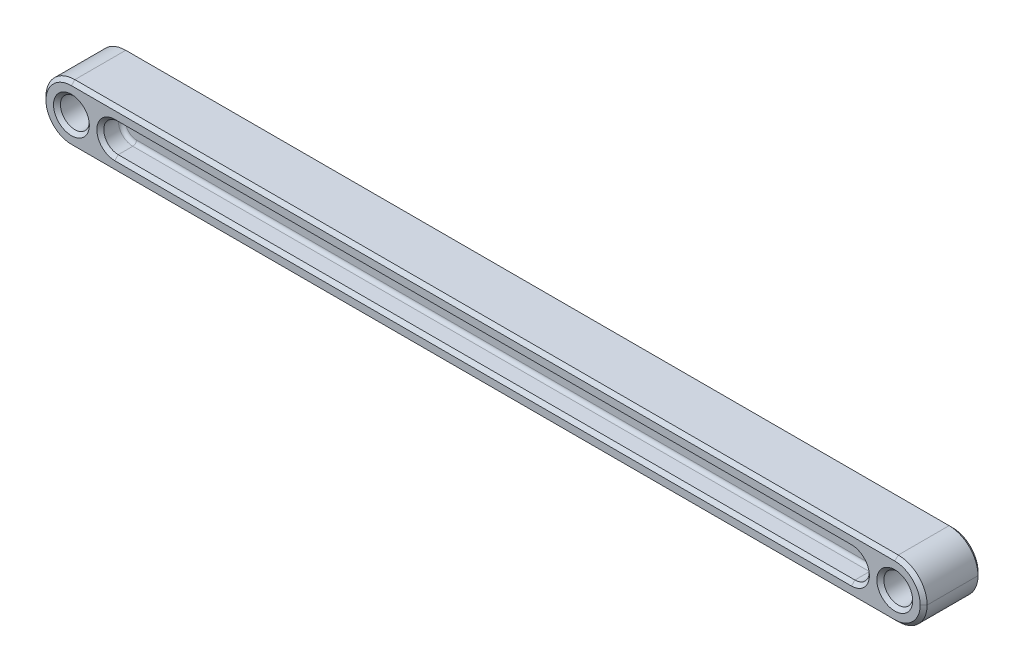
from build123d import *

# Parameters (mm, degrees)
SKETCH1_W                   = 12.7
SKETCH1_H                   = 12.7
BOSS_EXTRUDE1_DEPTH         = 96.8375
F_1_4_0_25_DIAMETER_HOLE1_D = 6.35
CUT_EXTRUDE1_START          = 6.35
CUT_EXTRUDE1_DEPTH          = 4.7625
CUT_EXTRUDE2_START          = -1.5875
CUT_EXTRUDE2_DEPTH          = 4.7625
FILLET1_R                   = 6.35
FILLET2_R                   = 0.79375
CHAMFER1_SIZE               = 0.762


with BuildPart() as part:
    # Sketch1 → Boss-Extrude1 (new, symmetric)
    with BuildSketch(Plane(origin=(0, 0, 0), x_dir=(0, 0, -1), z_dir=(1, 0, 0))):
        Rectangle(SKETCH1_W, SKETCH1_H)
    extrude(amount=BOSS_EXTRUDE1_DEPTH, both=True)

    # 1/4 (0.25) Diameter Hole1 (through all)
    with Locations(Plane.XY.offset(6.35)):
        with Locations((-90.4875, 0), (90.4875, 0)):
            Hole(F_1_4_0_25_DIAMETER_HOLE1_D / 2)

    # Sketch6 → Cut-Extrude1 (cut)
    with BuildSketch(Plane.XY.offset(CUT_EXTRUDE1_START)):
        with BuildLine():
            Line((-80.9625, 3.175), (80.9625, 3.175))
            ThreePointArc((80.9625, 3.175), (84.1375, 0), (80.9625, -3.175))
            Line((80.9625, -3.175), (-80.9625, -3.175))
            ThreePointArc((-80.9625, -3.175), (-84.1375, 0), (-80.9625, 3.175))
        make_face()
    extrude(amount=-CUT_EXTRUDE1_DEPTH, mode=Mode.SUBTRACT)

    # Sketch6<3> → Cut-Extrude2 (cut)
    with BuildSketch(Plane.XY.offset(CUT_EXTRUDE2_START)):
        with BuildLine():
            Line((-80.9625, 3.175), (80.9625, 3.175))
            ThreePointArc((80.9625, 3.175), (84.1375, 0), (80.9625, -3.175))
            Line((80.9625, -3.175), (-80.9625, -3.175))
            ThreePointArc((-80.9625, -3.175), (-84.1375, 0), (-80.9625, 3.175))
        make_face()
    extrude(amount=-CUT_EXTRUDE2_DEPTH, mode=Mode.SUBTRACT)

    # Fillet1
    fillet1_edges = [part.edges().sort_by_distance(p)[0] for p in [
        (96.8375, -6.35, 0),
        (96.8375, 6.35, 0),
        (-96.8375, -6.35, 0),
        (-96.8375, 6.35, 0),
    ]]
    fillet(fillet1_edges, radius=FILLET1_R - 0.0001)  # a hair under: the kernel refuses the full size

    # Fillet2
    fillet2_edges = [part.edges().sort_by_distance(p)[0] for p in [
        (84.1375, 0, 1.5875),
        (-84.1375, 0, 1.5875),
        (0, 3.175, 1.5875),
        (0, -3.175, 1.5875),
        (0, 3.175, -1.5875),
        (-84.1375, 0, -1.5875),
        (0, -3.175, -1.5875),
        (84.1375, 0, -1.5875),
    ]]
    fillet(fillet2_edges, radius=FILLET2_R)

    # Chamfer1
    chamfer1_edges = [part.edges().sort_by_distance(p)[0] for p in [
        (93.6625, 0, 6.35),
        (93.6625, 0, -6.35),
        (-87.3125, 0, 6.35),
        (-87.3125, 0, -6.35),
        (0, -3.175, 6.35),
        (84.1375, 0, 6.35),
        (0, 3.175, 6.35),
        (-84.1375, 0, 6.35),
        (0, 3.175, -6.35),
        (-84.1375, 0, -6.35),
        (0, -3.175, -6.35),
        (84.1375, 0, -6.35),
        (0, 6.35, -6.35),
        (0, -6.35, -6.35),
        (-94.97765735, 4.49015735, -6.35),
        (-94.97765735, -4.49015735, -6.35),
        (94.97765735, 4.49015735, -6.35),
        (94.97765735, -4.49015735, -6.35),
        (0, -6.35, 6.35),
        (0, 6.35, 6.35),
        (-94.97765735, 4.49015735, 6.35),
        (-94.97765735, -4.49015735, 6.35),
        (94.97765735, 4.49015735, 6.35),
        (94.97765735, -4.49015735, 6.35),
    ]]
    chamfer(chamfer1_edges, length=CHAMFER1_SIZE)


solid = part.part
